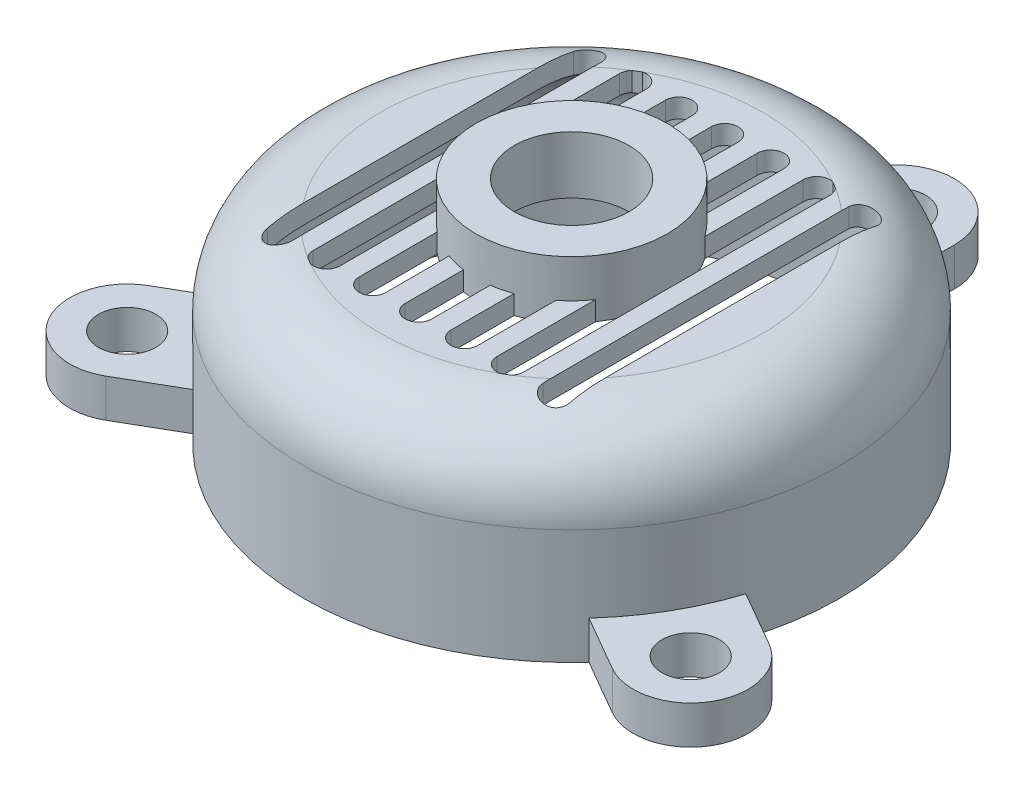
from build123d import *

# Parameters (mm, degrees)
BOSS_EXTRUDE1_START = 12.7
SKETCH2_R           = 9.525
BOSS_EXTRUDE1_DEPTH = 12.7
CUT_EXTRUDE1_DEPTH  = 182.17926462
BOSS_EXTRUDE2_START = -6.35
SKETCH5_R           = 31.75
BOSS_EXTRUDE2_DEPTH = 19.05
SKETCH6_R           = 19.05
CUT_EXTRUDE2_DEPTH  = 187.011063994


with BuildPart() as part:
    # Sketch1 → Revolve1 (revolve)
    with BuildSketch(Plane(origin=(0, 0, 0), x_dir=(0, 0, -1), z_dir=(1, 0, 0))):
        with BuildLine():
            Line((63.5, 63.5), (0, 63.5))
            Line((0, 63.5), (0, 57.15))
            Line((0, 57.15), (63.5, 57.15))
            ThreePointArc((63.5, 57.15), (76.970384182, 51.570384182), (82.55, 38.1))
            Line((82.55, 38.1), (82.55, 0))
            Line((82.55, 0), (88.9, 0))
            Line((88.9, 0), (88.9, 38.1))
            ThreePointArc((88.9, 38.1), (81.460512242, 56.060512242), (63.5, 63.5))
        make_face()
    revolve(axis=Axis((0, -95.453091684, 0), (0, 1, 0)))

    # Sketch2 → Boss-Extrude1 (add)
    # profile 1 of 3: a face of its own
    with BuildSketch(Plane(origin=(0, 0, 0), x_dir=(1, 0, 0), z_dir=(0, 1, 0)).offset(BOSS_EXTRUDE1_START)):
        with BuildLine():
            Line((-19.05, 107.95), (-19.05, 86.834944003))
            ThreePointArc((-19.05, 86.834944003), (0, 88.9), (19.05, 86.834944003))
            Line((19.05, 86.834944003), (19.05, 107.95))
            ThreePointArc((19.05, 107.95), (0, 127), (-19.05, 107.95))
        make_face()
        with Locations((0, 107.95)):
            Circle(SKETCH2_R, mode=Mode.SUBTRACT)
    # profile 2 of 3: a face of its own
    with BuildSketch(Plane(origin=(0, 0, 0), x_dir=(1, 0, 0), z_dir=(0, 1, 0)).offset(BOSS_EXTRUDE1_START)):
        with BuildLine():
            Line((103.012442339, -37.477216058), (84.726267443, -26.919688059))
            ThreePointArc((84.726267443, -26.919688059), (76.989658396, -44.45), (65.676267443, -59.915255944))
            Line((65.676267443, -59.915255944), (83.962442339, -70.472783942))
            ThreePointArc((83.962442339, -70.472783942), (109.985226281, -63.5), (103.012442339, -37.477216058))
        make_face()
        with Locations((93.487442339, -53.975)):
            Circle(SKETCH2_R, mode=Mode.SUBTRACT)
    # profile 3 of 3: a face of its own
    with BuildSketch(Plane(origin=(0, 0, 0), x_dir=(1, 0, 0), z_dir=(0, 1, 0)).offset(BOSS_EXTRUDE1_START)):
        with BuildLine():
            Line((-83.962442339, -70.472783942), (-65.676267443, -59.915255944))
            ThreePointArc((-65.676267443, -59.915255944), (-76.989658396, -44.45), (-84.726267443, -26.919688059))
            Line((-84.726267443, -26.919688059), (-103.012442339, -37.477216058))
            ThreePointArc((-103.012442339, -37.477216058), (-109.985226281, -63.5), (-83.962442339, -70.472783942))
        make_face()
        with Locations((-93.487442339, -53.975)):
            Circle(SKETCH2_R, mode=Mode.SUBTRACT)
    extrude(amount=-BOSS_EXTRUDE1_DEPTH)

    # Sketch3 → Cut-Extrude1 (cut, through all)
    with BuildSketch(Plane(origin=(0, 63.5, 0), x_dir=(1, 0, 0), z_dir=(0, 1, 0))):
        with BuildLine():
            Line((4.445, -50.8), (4.445, 50.8))
            ThreePointArc((4.445, 50.8), (0, 55.245), (-4.445, 50.8))
            Line((-4.445, 50.8), (-4.445, -50.8))
            ThreePointArc((-4.445, -50.8), (0, -55.245), (4.445, -50.8))
        make_face()
        with BuildLine():
            Line((19.685, -50.8), (19.685, 50.8))
            ThreePointArc((19.685, 50.8), (15.24, 55.245), (10.795, 50.8))
            Line((10.795, 50.8), (10.795, -50.8))
            ThreePointArc((10.795, -50.8), (15.24, -55.245), (19.685, -50.8))
        make_face()
        with BuildLine():
            Line((34.925, -50.8), (34.925, 50.8))
            ThreePointArc((34.925, 50.8), (34.633511794, 52.383150271), (33.797276814, 53.758665161))
            ThreePointArc((33.797276814, 53.758665161), (32.67048047, 54.450800783), (31.529515465, 55.119321971))
            ThreePointArc((31.529515465, 55.119321971), (27.732917115, 54.294504346), (26.035, 50.8))
            Line((26.035, 50.8), (26.035, -50.8))
            ThreePointArc((26.035, -50.8), (27.732917115, -54.294504346), (31.529515465, -55.119321971))
            ThreePointArc((31.529515465, -55.119321971), (32.67048047, -54.450800783), (33.797276814, -53.758665161))
            ThreePointArc((33.797276814, -53.758665161), (34.633511794, -52.383150271), (34.925, -50.8))
        make_face()
        with BuildLine():
            ThreePointArc((50.165, 50.8), (45.72, 55.245), (41.275, 50.8))
            Line((41.275, 50.8), (41.275, -50.8))
            ThreePointArc((41.275, -50.8), (45.72, -55.245), (50.165, -50.8))
            Line((50.165, -50.8), (50.165, 50.8))
        make_face()
        with BuildLine():
            ThreePointArc((-26.035, 50.8), (-27.732917115, 54.294504346), (-31.529515465, 55.119321971))
            ThreePointArc((-31.529515465, 55.119321971), (-32.67048047, 54.450800783), (-33.797276814, 53.758665161))
            ThreePointArc((-33.797276814, 53.758665161), (-34.633511794, 52.383150271), (-34.925, 50.8))
            Line((-34.925, 50.8), (-34.925, -50.8))
            ThreePointArc((-34.925, -50.8), (-34.633511794, -52.383150271), (-33.797276814, -53.758665161))
            ThreePointArc((-33.797276814, -53.758665161), (-32.67048047, -54.450800783), (-31.529515465, -55.119321971))
            ThreePointArc((-31.529515465, -55.119321971), (-27.732917115, -54.294504346), (-26.035, -50.8))
            Line((-26.035, -50.8), (-26.035, 50.8))
        make_face()
        with BuildLine():
            Line((-50.165, 50.8), (-50.165, -50.8))
            ThreePointArc((-50.165, -50.8), (-45.72, -55.245), (-41.275, -50.8))
            Line((-41.275, -50.8), (-41.275, 50.8))
            ThreePointArc((-41.275, 50.8), (-45.72, 55.245), (-50.165, 50.8))
        make_face()
        with BuildLine():
            Line((-10.795, -50.8), (-10.795, 50.8))
            ThreePointArc((-10.795, 50.8), (-15.24, 55.245), (-19.685, 50.8))
            Line((-19.685, 50.8), (-19.685, -50.8))
            ThreePointArc((-19.685, -50.8), (-15.24, -55.245), (-10.795, -50.8))
        make_face()
    extrude(amount=-CUT_EXTRUDE1_DEPTH, mode=Mode.SUBTRACT)

    # Sketch5 → Boss-Extrude2 (add)
    with BuildSketch(Plane(origin=(0, 63.5, 0), x_dir=(1, 0, 0), z_dir=(0, 1, 0)).offset(BOSS_EXTRUDE2_START)):
        Circle(SKETCH5_R)
    extrude(amount=BOSS_EXTRUDE2_DEPTH)

    # Sketch6 → Cut-Extrude2 (cut, through all)
    with BuildSketch(Plane(origin=(0, 76.2, 0), x_dir=(1, 0, 0), z_dir=(0, 1, 0))):
        Circle(SKETCH6_R)
    extrude(amount=-CUT_EXTRUDE2_DEPTH, mode=Mode.SUBTRACT)


solid = part.part
